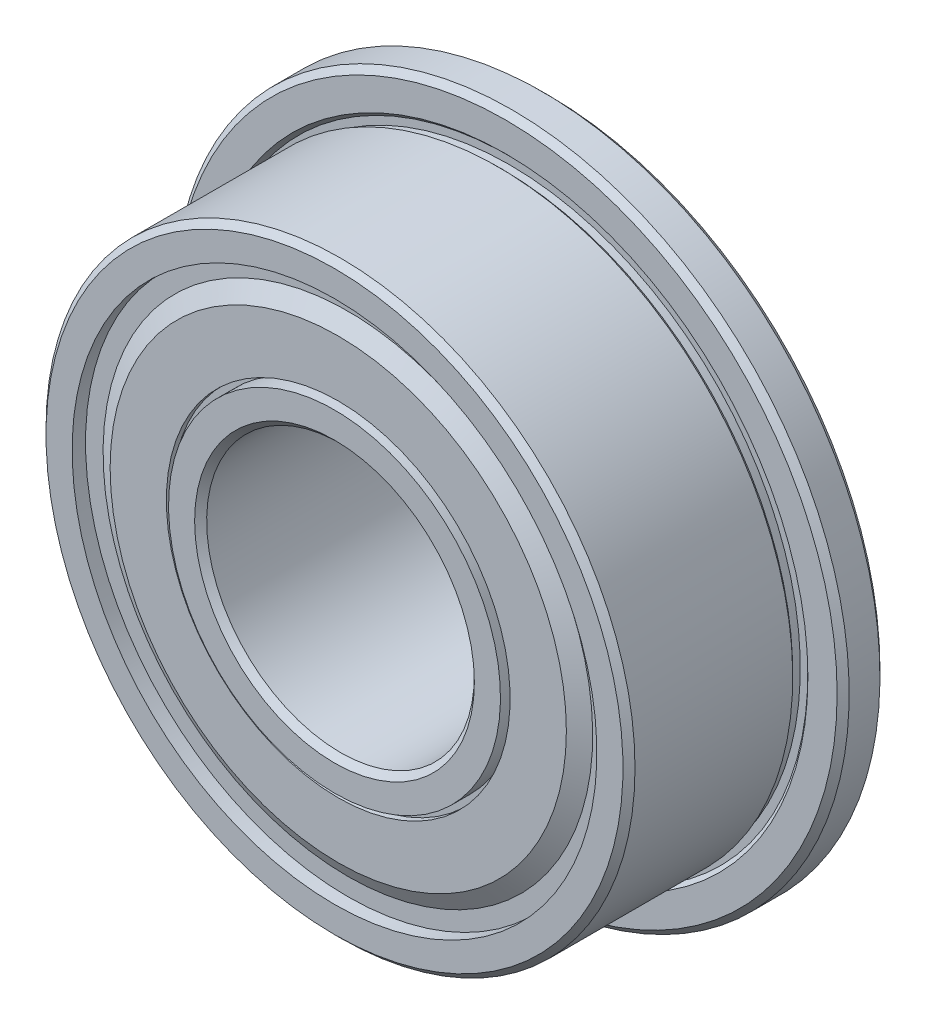
from build123d import *

# Parameters (mm, degrees)
FILLET1_SIZE      = 0.1125
FILLET2_SIZE      = 0.1125
CIRPATTERN3_COUNT = 13
SKETCH8_W         = 0.36
SKETCH8_H         = 0.3


with BuildPart() as part:
    # Sketch2 → Revolve1 (revolve)
    with BuildSketch(Plane(origin=(0, 0, 0), x_dir=(0, 0, -1), z_dir=(1, 0, 0))):
        with BuildLine():
            Line((2, 6.3), (1.2, 6.3))
            Line((1.2, 6.3), (1.2, 5.641421356))
            Line((1.2, 5.641421356), (1.270710678, 5.570710678))
            Line((1.270710678, 5.570710678), (1.270710678, 5.429289322))
            Line((1.270710678, 5.429289322), (1.129289322, 5.429289322))
            Line((1.129289322, 5.429289322), (1.058578644, 5.5))
            Line((1.058578644, 5.5), (-2, 5.5))
            Line((-2, 5.5), (-2, 4.6))
            Line((-2, 4.6), (-0.45, 4.6))
            ThreePointArc((-0.45, 4.6), (0, 4.75), (0.45, 4.6))
            Line((0.45, 4.6), (2, 4.6))
            Line((2, 4.6), (2, 6.3))
        make_face()
        with BuildLine():
            Line((2, 2.5), (-2, 2.5))
            Line((-2, 2.5), (-2, 3.4))
            Line((-2, 3.4), (-0.45, 3.4))
            ThreePointArc((-0.45, 3.4), (0, 3.25), (0.45, 3.4))
            Line((0.45, 3.4), (2, 3.4))
            Line((2, 3.4), (2, 2.5))
        make_face()
    revolve(axis=Axis((0, 0, 0), (0, 0, -1)))

    # Fillet1
    fillet1_edges = [part.edges().sort_by_distance(p)[0] for p in [
        (0, -6.3, -2),
        (0, -6.3, -1.2),
        (0, -5.5, 2),
    ]]
    chamfer(fillet1_edges, length=FILLET1_SIZE)

    # Fillet2
    fillet2_edges = [part.edges().sort_by_distance(p)[0] for p in [
        (0, -2.5, -2),
        (0, -2.5, 2),
    ]]
    chamfer(fillet2_edges, length=FILLET2_SIZE)

    # Sketch8 → Cut-Revolve1 (revolve, cut)
    with BuildSketch(Plane(origin=(0, 0, 0), x_dir=(0, 0, -1), z_dir=(1, 0, 0))):
        with Locations((-1.82, 4.75)):
            Rectangle(SKETCH8_W, SKETCH8_H)
        with Locations((1.82, 4.75)):
            Rectangle(SKETCH8_W, SKETCH8_H)
        with Locations((1.82, 3.25)):
            Rectangle(SKETCH8_W, SKETCH8_H)
        with Locations((-1.82, 3.25)):
            Rectangle(SKETCH8_W, SKETCH8_H)
    revolve(axis=Axis((0, 0, 0), (0, 0, -1)), mode=Mode.SUBTRACT)


with BuildPart() as body_2:
    # Sketch7 → Revolve3 (revolve)
    with BuildSketch(Plane.XY):
        with BuildLine():
            Line((0, 4.75), (0, 3.25))
            ThreePointArc((0, 3.25), (-0.75, 4), (0, 4.75))
        make_face()
    revolve(axis=Axis((0, 4.75, 0), (0, -1, 0)))


with BuildPart() as cirpattern3_1:
    # CirPattern3: pattern copy
    add(body_2.part.rotate(Axis((0, 0, 0), (0, 0, -1)), 1 * 360 / CIRPATTERN3_COUNT))


with BuildPart() as cirpattern3_2:
    # CirPattern3: pattern copy
    add(body_2.part.rotate(Axis((0, 0, 0), (0, 0, -1)), 2 * 360 / CIRPATTERN3_COUNT))


with BuildPart() as cirpattern3_3:
    # CirPattern3: pattern copy
    add(body_2.part.rotate(Axis((0, 0, 0), (0, 0, -1)), 3 * 360 / CIRPATTERN3_COUNT))


with BuildPart() as cirpattern3_4:
    # CirPattern3: pattern copy
    add(body_2.part.rotate(Axis((0, 0, 0), (0, 0, -1)), 4 * 360 / CIRPATTERN3_COUNT))


with BuildPart() as cirpattern3_5:
    # CirPattern3: pattern copy
    add(body_2.part.rotate(Axis((0, 0, 0), (0, 0, -1)), 5 * 360 / CIRPATTERN3_COUNT))


with BuildPart() as cirpattern3_6:
    # CirPattern3: pattern copy
    add(body_2.part.rotate(Axis((0, 0, 0), (0, 0, -1)), 6 * 360 / CIRPATTERN3_COUNT))


with BuildPart() as cirpattern3_7:
    # CirPattern3: pattern copy
    add(body_2.part.rotate(Axis((0, 0, 0), (0, 0, -1)), 7 * 360 / CIRPATTERN3_COUNT))


with BuildPart() as cirpattern3_8:
    # CirPattern3: pattern copy
    add(body_2.part.rotate(Axis((0, 0, 0), (0, 0, -1)), 8 * 360 / CIRPATTERN3_COUNT))


with BuildPart() as cirpattern3_9:
    # CirPattern3: pattern copy
    add(body_2.part.rotate(Axis((0, 0, 0), (0, 0, -1)), 9 * 360 / CIRPATTERN3_COUNT))


with BuildPart() as cirpattern3_10:
    # CirPattern3: pattern copy
    add(body_2.part.rotate(Axis((0, 0, 0), (0, 0, -1)), 10 * 360 / CIRPATTERN3_COUNT))


with BuildPart() as cirpattern3_11:
    # CirPattern3: pattern copy
    add(body_2.part.rotate(Axis((0, 0, 0), (0, 0, -1)), 11 * 360 / CIRPATTERN3_COUNT))


with BuildPart() as cirpattern3_12:
    # CirPattern3: pattern copy
    add(body_2.part.rotate(Axis((0, 0, 0), (0, 0, -1)), 12 * 360 / CIRPATTERN3_COUNT))


with BuildPart() as body_15:
    # Sketch9 → Revolve4 (revolve)
    with BuildSketch(Plane(origin=(0, 0, 0), x_dir=(0, 0, -1), z_dir=(1, 0, 0))):
        Polygon((-1.64, 4.9), (-1.64, 4.542857143), (-1.82, 4.231087997), (-1.82, 3.21), (-1.93, 3.21), (-1.93, 4.260562409), (-1.75, 4.572331554), (-1.75, 4.9), align=None)
        Polygon((1.64, 4.9), (1.64, 4.542857143), (1.82, 4.231087997), (1.82, 3.21), (1.91, 3.21), (1.91, 4.255203425), (1.73, 4.56697257), (1.73, 4.9), align=None)
    revolve(axis=Axis((0, 0, 0), (0, 0, -1)))


solid = Compound([part.part, body_2.part, cirpattern3_1.part, cirpattern3_2.part, cirpattern3_3.part, cirpattern3_4.part, cirpattern3_5.part, cirpattern3_6.part, cirpattern3_7.part, cirpattern3_8.part, cirpattern3_9.part, cirpattern3_10.part, cirpattern3_11.part, cirpattern3_12.part, body_15.part])
